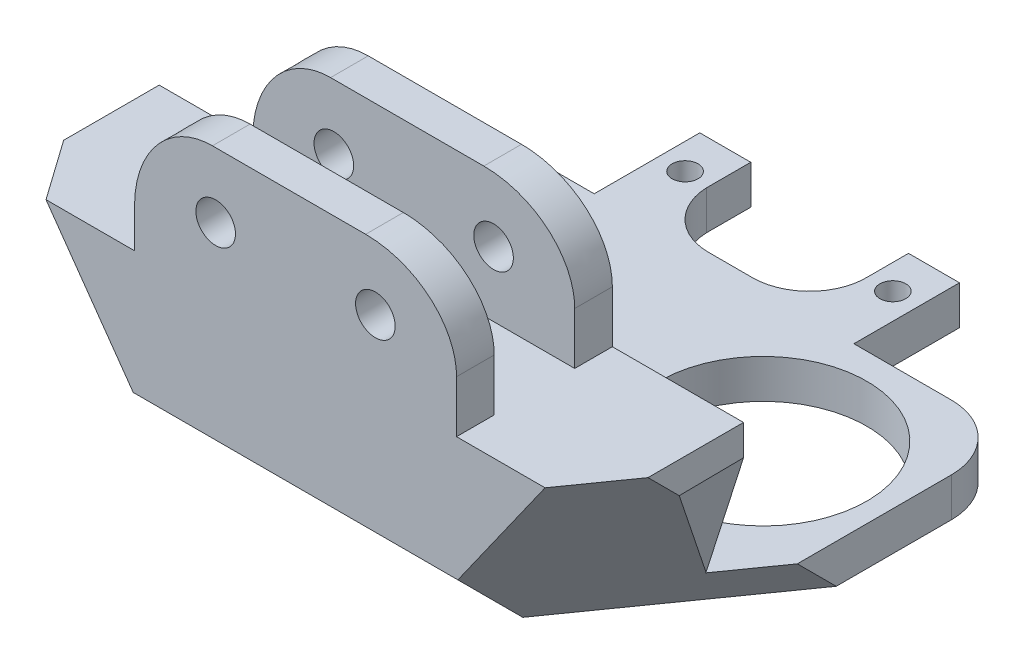
from build123d import *

# Parameters (mm, degrees)
SKETCH1_W           = 45
SKETCH1_H           = 20
SKETCH1_R           = 8
SKETCH1_H_2         = 13
SKETCH1_H_3         = 1
BOSS_EXTRUDE1_DEPTH = 3
SKETCH3_W           = 45
SKETCH3_H           = 2.9
SKETCH3_H_2         = 6.2
BOSS_EXTRUDE2_DEPTH = 11.5
SKETCH3_3_W         = 45
SKETCH3_3_H         = 2.9
BOSS_EXTRUDE3_DEPTH = 21.5
SKETCH6_R           = 1.525
SKETCH6_W           = 10.1
SKETCH6_H           = 10
CUT_EXTRUDE2_DEPTH  = 16.5
CHAMFER1_SIZE       = 5
FILLET2_R           = 5
FILLET3_SIZE        = 7
FILLET3_SIZE_2      = 6
SKETCH7_R           = 0.996709825
SKETCH7_R_2         = 1
BOSS_EXTRUDE4_DEPTH = 3
CHAMFER2_SIZE       = 10
CHAMFER3_SIZE       = 10
CHAMFER4_START      = 17.731133084
CHAMFER4_DEPTH      = 3.699865449
CHAMFER5_START      = -16.752681828
CHAMFER5_DEPTH      = 1.71299366


with BuildPart() as part:
    # Sketch1 → Boss-Extrude1 (new body)
    # profile 1 of 3: a face of its own
    with BuildSketch(Plane(origin=(0, 0, 0), x_dir=(1, 0, 0), z_dir=(0, 1, 0))):
        Rectangle(SKETCH1_W, SKETCH1_H)
        with Locations(Location((13, 0, 0), (0, 0, 270))):
            Circle(SKETCH1_R, mode=Mode.SUBTRACT)
        with Locations(Location((-13, 0, 0), (0, 0, 270))):
            Circle(SKETCH1_R, mode=Mode.SUBTRACT)
    # profile 2 of 3: a face of its own
    with BuildSketch(Plane(origin=(0, 0, 0), x_dir=(1, 0, 0), z_dir=(0, 1, 0))):
        with Locations((0, -16.5)):
            Rectangle(SKETCH1_W, SKETCH1_H_2)
    # profile 3 of 3: a face of its own
    with BuildSketch(Plane(origin=(0, 0, 0), x_dir=(1, 0, 0), z_dir=(0, 1, 0))):
        with Locations((0, -10.5)):
            Rectangle(SKETCH1_W, SKETCH1_H_3)
    extrude(amount=BOSS_EXTRUDE1_DEPTH)

    # Sketch3 → Boss-Extrude2 (add)
    with BuildSketch(Plane(origin=(0, 3, 0), x_dir=(1, 0, 0), z_dir=(0, 1, 0))):
        with Locations((0, -21.55)):
            Rectangle(SKETCH3_W, SKETCH3_H)
        with Locations((0, -17)):
            Rectangle(SKETCH3_W, SKETCH3_H_2)
        with Locations((0, -12.45)):
            Rectangle(SKETCH3_W, SKETCH3_H)
    extrude(amount=BOSS_EXTRUDE2_DEPTH)

    # Sketch3<3> → Boss-Extrude3 (add)
    with BuildSketch(Plane(origin=(0, 3, 0), x_dir=(1, 0, 0), z_dir=(0, 1, 0))):
        with Locations((0, -12.45)):
            Rectangle(SKETCH3_3_W, SKETCH3_3_H)
        with Locations((0, -21.55)):
            Rectangle(SKETCH3_3_W, SKETCH3_3_H)
    extrude(amount=BOSS_EXTRUDE3_DEPTH)

    # Sketch6 → Cut-Extrude2 (cut)
    with BuildSketch(Plane(origin=(0, 0, 11), x_dir=(-1, 0, 0), z_dir=(0, 0, -1))):
        with Locations((-6.15, 19.5)):
            Circle(SKETCH6_R)
        with Locations((6.15, 19.5)):
            Circle(SKETCH6_R)
        with Locations((-17.45, 19.5)):
            Rectangle(SKETCH6_W, SKETCH6_H)
        with Locations((17.45, 19.5)):
            Rectangle(SKETCH6_W, SKETCH6_H)
    extrude(amount=-CUT_EXTRUDE2_DEPTH, mode=Mode.SUBTRACT)

    # Chamfer1
    chamfer1_edges = [part.edges().sort_by_distance(p)[0] for p in [
        (0, 0, 23),
    ]]
    chamfer(chamfer1_edges, length=CHAMFER1_SIZE)

    # Fillet2
    fillet2_edges = [part.edges().sort_by_distance(p)[0] for p in [
        (-22.5, 1.5, -10),
        (22.5, 1.5, -10),
    ]]
    fillet(fillet2_edges, radius=FILLET2_R)

    # Fillet3
    # a fillet whose section is not a circle: 7, 6 mm, written as the material it takes off along each edge
    with BuildSketch(Plane(origin=(12.4, 24.5, -6.5), x_dir=(-1, 0, 0), z_dir=(0, 0, 1)), Plane(origin=(-12.4, 24.5, -6.5), x_dir=(0, -1, 0), z_dir=(0, 0, 1))) as fillet3_piece_1:
        with BuildLine():
            Bezier((FILLET3_SIZE, 0), (0, 0), (0, FILLET3_SIZE_2), weights=[1, 0.707106781, 1])
            Line((0, FILLET3_SIZE_2), (0, 0))
            Line((0, 0), (FILLET3_SIZE, 0))
        make_face()
    extrude(amount=37.9, mode=Mode.SUBTRACT)
    with BuildSketch(Plane(origin=(12.4, 24.5, 2.6), x_dir=(0, -1, 0), z_dir=(0, 0, 1)), Plane(origin=(-12.4, 24.5, 2.6), x_dir=(1, 0, 0), z_dir=(0, 0, 1))) as fillet3_piece_2:
        with BuildLine():
            Bezier((FILLET3_SIZE_2, 0), (0, 0), (0, -FILLET3_SIZE), weights=[1, 0.707106781, 1])
            Line((0, -FILLET3_SIZE), (0, 0))
            Line((0, 0), (FILLET3_SIZE_2, 0))
        make_face()
    extrude(amount=37.9, mode=Mode.SUBTRACT)

    # Sketch7 → Boss-Extrude4 (add)
    with BuildSketch(Plane.XZ):
        with BuildLine():
            Line((-10, -10), (10, -10))
            Line((10, -10), (10, -18.132118098))
            Line((10, -18.132118098), (6.075, -18.132118098))
            Line((6.075, -18.132118098), (6.075, -15.047815402))
            ThreePointArc((6.075, -15.047815402), (4.848419821, -11.842215517), (1.689491671, -10.5))
            Line((1.689491671, -10.5), (-1.689458819, -10.5))
            ThreePointArc((-1.689458819, -10.5), (-4.736103523, -11.729921298), (-6.075, -14.730272374))
            Line((-6.075, -14.730272374), (-6.075, -18.132118098))
            Line((-6.075, -18.132118098), (-10, -18.132118098))
            Line((-10, -18.132118098), (-10, -10))
        make_face()
        with Locations(Location((8, -15, 0), (0, 0, 270))):
            Circle(SKETCH7_R, mode=Mode.SUBTRACT)
        with Locations(Location((-8, -15, 0), (0, 0, 270))):
            Circle(SKETCH7_R_2, mode=Mode.SUBTRACT)
    extrude(amount=-BOSS_EXTRUDE4_DEPTH)

    # Chamfer2
    # the kernel refuses this chamfer: 10 mm, written as the material it takes off along each edge
    with BuildSketch(Plane(origin=(22.5, 23.184544799, 41.184544799), x_dir=(0, 0.7071067811865476, -0.7071067811865476), z_dir=(0, -0.7071067811865476, -0.7071067811865476))) as chamfer2_piece_1:
        Polygon((CHAMFER2_SIZE, 0), (0, -CHAMFER2_SIZE), (0, 0), align=None)
    extrude(amount=58.504727571, mode=Mode.SUBTRACT)

    # Chamfer3
    # the kernel refuses this chamfer: 10 mm, written as the material it takes off along each edge
    with BuildSketch(Plane(origin=(-22.5, 23.184544799, 41.184544799), x_dir=(1, 0, 0), z_dir=(0, -0.7071067811865476, -0.7071067811865476))) as chamfer3_piece_1:
        Polygon((CHAMFER3_SIZE, 0), (0, -CHAMFER3_SIZE), (0, 0), align=None)
    extrude(amount=58.504727571, mode=Mode.SUBTRACT)

    # Chamfer4: read off the stored shape, not the designer's step
    # Chamfer4 outline → Chamfer4 (cut)
    with BuildSketch(Plane(origin=(0, 0, 0), x_dir=(0.3029024372169638, 0.9530210691127028, -0.0009774227869083028), z_dir=(0.9530161074355918, -0.302904014214538, -0.0030752464993570898)).offset(CHAMFER4_START)):
        Polygon((8.846062674, 11.063231546), (18.37626426, 11.072546631), (18.323534543, 16.02226833), align=None)
    extrude(amount=CHAMFER4_DEPTH, mode=Mode.SUBTRACT)

    # Chamfer5: read off the stored shape, not the designer's step
    # Chamfer5 outline → Chamfer5 (cut)
    with BuildSketch(Plane(origin=(0, 0, 0), x_dir=(-0.2371114626358165, 0.9695954628947141, -0.06052100974611115), z_dir=(0.9394753911891737, 0.24471337996518516, 0.2397943932121102)).offset(CHAMFER5_START)):
        Polygon((18.381427339, 16.222851439), (14.80832265, 19.648555484), (6.951420363, 15.508917831), align=None)
    extrude(amount=CHAMFER5_DEPTH, mode=Mode.SUBTRACT)


solid = part.part
